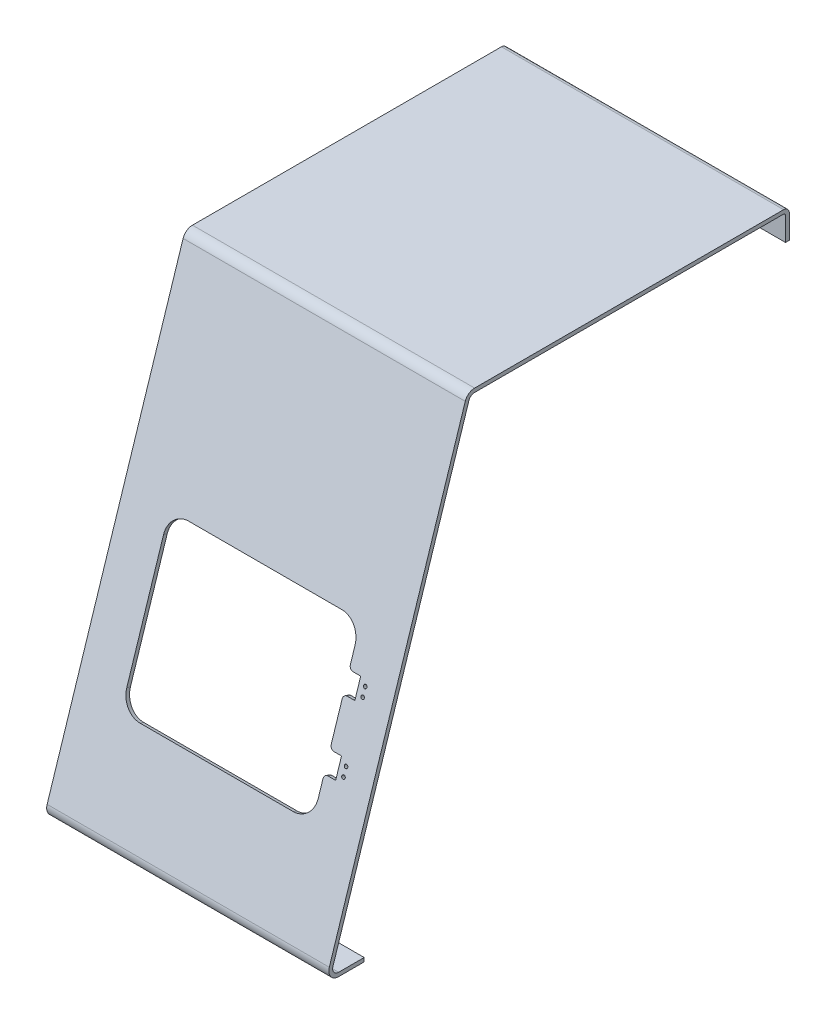
from build123d import *

# Parameters (mm, degrees)
EXTRUDE_THIN1_DEPTH = 110.5
CUT_EXTRUDE1_REACH  = 444.866
SKETCH2_R           = 1.35


with BuildPart() as part:
    # Sketch1 → Extrude-Thin1 (new, symmetric)
    with BuildSketch(Plane(origin=(0, 0, 0), x_dir=(0, 0, -1), z_dir=(1, 0, 0))):
        with BuildLine():
            Line((122.5, 310), (122.5, 328.5))
            ThreePointArc((122.5, 328.5), (122.060660172, 329.560660172), (121, 330))
            Line((121, 330), (-121.0014, 330))
            ThreePointArc((-121.0014, 330), (-123.764798126, 329.10018419), (-125.468557887, 326.745775479))
            Line((-125.468557887, 326.745775479), (-231.967157887, -3.867817213))
            ThreePointArc((-231.967157887, -3.867817213), (-231.293387843, -8.070194473), (-227.5, -10))
            Line((-227.5, -10), (-207.5, -10))
            Line((-207.5, -10), (-207.5, -13))
            Line((-207.5, -13), (-227.5, -13))
            ThreePointArc((-227.5, -13), (-233.718205595, -9.836619923), (-234.822664414, -2.947989795))
            Line((-234.822664414, -2.947989795), (-128.324064414, 327.665602897))
            ThreePointArc((-128.324064414, 327.665602897), (-125.531223577, 331.525001941), (-121.0014, 333))
            Line((-121.0014, 333), (121, 333))
            ThreePointArc((121, 333), (124.181980515, 331.681980515), (125.5, 328.5))
            Line((125.5, 328.5), (125.5, 310))
            Line((125.5, 310), (122.5, 310))
        make_face()
    extrude(amount=EXTRUDE_THIN1_DEPTH, both=True)

    # Sketch2 → Cut-Extrude1 (cut, up to next)
    with BuildSketch(Plane(origin=(0, 68.253852605, 211.886836303), x_dir=(1, 0, 0), z_dir=(0, 0.30660913934042044, 0.9518355087266532)), mode=Mode.PRIVATE) as cut_extrude1_sk1:
        with Locations((88.85, 87.672559187)):
            Circle(SKETCH2_R)
    cut_extrude1_tool1 = extrude(cut_extrude1_sk1.sketch, amount=-CUT_EXTRUDE1_REACH, mode=Mode.PRIVATE) & part.part
    # Sketch2 → Cut-Extrude1 (cut, up to next)
    with BuildSketch(Plane(origin=(0, 68.253852605, 211.886836303), x_dir=(1, 0, 0), z_dir=(0, 0.30660913934042044, 0.9518355087266532)), mode=Mode.PRIVATE) as cut_extrude1_sk2:
        with Locations((88.85, 81.072559187)):
            Circle(SKETCH2_R)
    cut_extrude1_tool2 = extrude(cut_extrude1_sk2.sketch, amount=-CUT_EXTRUDE1_REACH, mode=Mode.PRIVATE) & part.part
    # Sketch2 → Cut-Extrude1 (cut, up to next)
    with BuildSketch(Plane(origin=(0, 68.253852605, 211.886836303), x_dir=(1, 0, 0), z_dir=(0, 0.30660913934042044, 0.9518355087266532)), mode=Mode.PRIVATE) as cut_extrude1_sk3:
        with Locations((88.85, 38.672559187)):
            Circle(SKETCH2_R)
    cut_extrude1_tool3 = extrude(cut_extrude1_sk3.sketch, amount=-CUT_EXTRUDE1_REACH, mode=Mode.PRIVATE) & part.part
    # Sketch2 → Cut-Extrude1 (cut, up to next)
    with BuildSketch(Plane(origin=(0, 68.253852605, 211.886836303), x_dir=(1, 0, 0), z_dir=(0, 0.30660913934042044, 0.9518355087266532)), mode=Mode.PRIVATE) as cut_extrude1_sk4:
        with Locations((88.85, 32.072559187)):
            Circle(SKETCH2_R)
    cut_extrude1_tool4 = extrude(cut_extrude1_sk4.sketch, amount=-CUT_EXTRUDE1_REACH, mode=Mode.PRIVATE) & part.part
    # Sketch2 → Cut-Extrude1 (cut, up to next)
    with BuildSketch(Plane(origin=(0, 68.253852605, 211.886836303), x_dir=(1, 0, 0), z_dir=(0, 0.30660913934042044, 0.9518355087266532)), mode=Mode.PRIVATE) as cut_extrude1_sk5:
        with BuildLine():
            Line((-60, 121.872559187), (60, 121.872559187))
            ThreePointArc((60, 121.872559187), (70.606601718, 117.479160904), (75, 106.872559187))
            Line((75, 106.872559187), (75, 94.872559187))
            ThreePointArc((75, 94.872559187), (75.878679656, 92.751238843), (78, 91.872559187))
            Line((78, 91.872559187), (84, 91.872559187))
            Line((84, 91.872559187), (84, 76.872559187))
            Line((84, 76.872559187), (78, 76.872559187))
            ThreePointArc((78, 76.872559187), (75.878679656, 75.99387953), (75, 73.872559187))
            Line((75, 73.872559187), (75, 45.872559187))
            ThreePointArc((75, 45.872559187), (75.878679656, 43.751238843), (78, 42.872559187))
            Line((78, 42.872559187), (84, 42.872559187))
            Line((84, 42.872559187), (84, 27.872559187))
            Line((84, 27.872559187), (78, 27.872559187))
            ThreePointArc((78, 27.872559187), (75.878679656, 26.99387953), (75, 24.872559187))
            Line((75, 24.872559187), (75, 12.872559187))
            ThreePointArc((75, 12.872559187), (70.606601718, 2.265957469), (60, -2.127440813))
            Line((60, -2.127440813), (-60, -2.127440813))
            ThreePointArc((-60, -2.127440813), (-70.606601718, 2.265957469), (-75, 12.872559187))
            Line((-75, 12.872559187), (-75, 106.872559187))
            ThreePointArc((-75, 106.872559187), (-70.606601718, 117.479160904), (-60, 121.872559187))
        make_face()
    cut_extrude1_tool5 = extrude(cut_extrude1_sk5.sketch, amount=-CUT_EXTRUDE1_REACH, mode=Mode.PRIVATE) & part.part
    add(cut_extrude1_tool1.solids().sort_by_distance((88.85, 151.703708, 185.005628))[0], mode=Mode.SUBTRACT)
    add(cut_extrude1_tool2.solids().sort_by_distance((88.85, 145.421593, 187.029249))[0], mode=Mode.SUBTRACT)
    add(cut_extrude1_tool3.solids().sort_by_distance((88.85, 105.063768, 200.029476))[0], mode=Mode.SUBTRACT)
    add(cut_extrude1_tool4.solids().sort_by_distance((88.85, 98.781653, 202.053097))[0], mode=Mode.SUBTRACT)
    add(cut_extrude1_tool5.solids().sort_by_distance((1.180096, 125.24268, 193.529362))[0], mode=Mode.SUBTRACT)


solid = part.part
